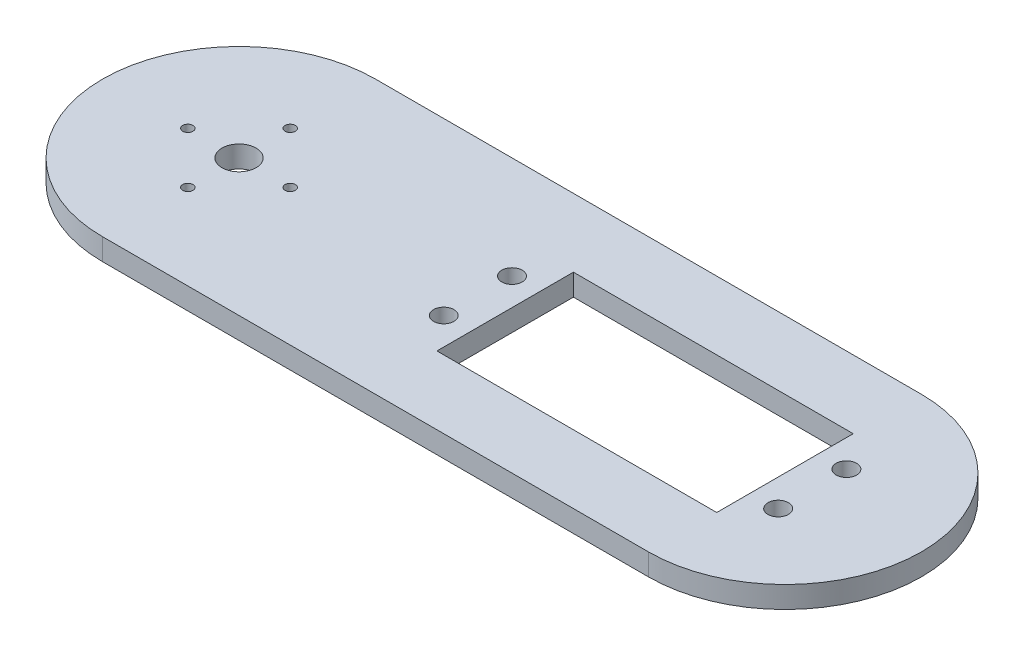
from build123d import *

# Parameters (mm, degrees)
SKETCH3_R           = 2.5
SKETCH3_R_2         = 0.75
SKETCH3_R_3         = 1.5
SKETCH3_W           = 41
SKETCH3_H           = 20
BOSS_EXTRUDE1_DEPTH = 3.175


with BuildPart() as part:
    # Sketch3 → Boss-Extrude1 (new body)
    with BuildSketch(Plane(origin=(0, 0, 0), x_dir=(1, 0, 0), z_dir=(0, 1, 0))):
        with BuildLine():
            Line((-40.372263643, 20), (39.627736357, 20))
            ThreePointArc((39.627736357, 20), (59.627736357, 0), (39.627736357, -20))
            Line((39.627736357, -20), (-40.372263643, -20))
            ThreePointArc((-40.372263643, -20), (-60.372263643, 0), (-40.372263643, 20))
        make_face()
        with Locations((-40.372263643, 0)):
            Circle(SKETCH3_R, mode=Mode.SUBTRACT)
        with Locations((-32.872263643, 0)):
            Circle(SKETCH3_R_2, mode=Mode.SUBTRACT)
        with Locations((-5.372263643, 5)):
            Circle(SKETCH3_R_3, mode=Mode.SUBTRACT)
        with Locations((-5.372263643, -5)):
            Circle(SKETCH3_R_3, mode=Mode.SUBTRACT)
        with Locations((43.627736357, 5)):
            Circle(SKETCH3_R_3, mode=Mode.SUBTRACT)
        with Locations((43.627736357, -5)):
            Circle(SKETCH3_R_3, mode=Mode.SUBTRACT)
        with Locations((-47.872263643, 0)):
            Circle(SKETCH3_R_2, mode=Mode.SUBTRACT)
        with Locations((-40.372263643, 7.5)):
            Circle(SKETCH3_R_2, mode=Mode.SUBTRACT)
        with Locations((-40.372263643, -7.5)):
            Circle(SKETCH3_R_2, mode=Mode.SUBTRACT)
        with Locations((19.127736357, 0)):
            Rectangle(SKETCH3_W, SKETCH3_H, mode=Mode.SUBTRACT)
    extrude(amount=BOSS_EXTRUDE1_DEPTH)


solid = part.part
